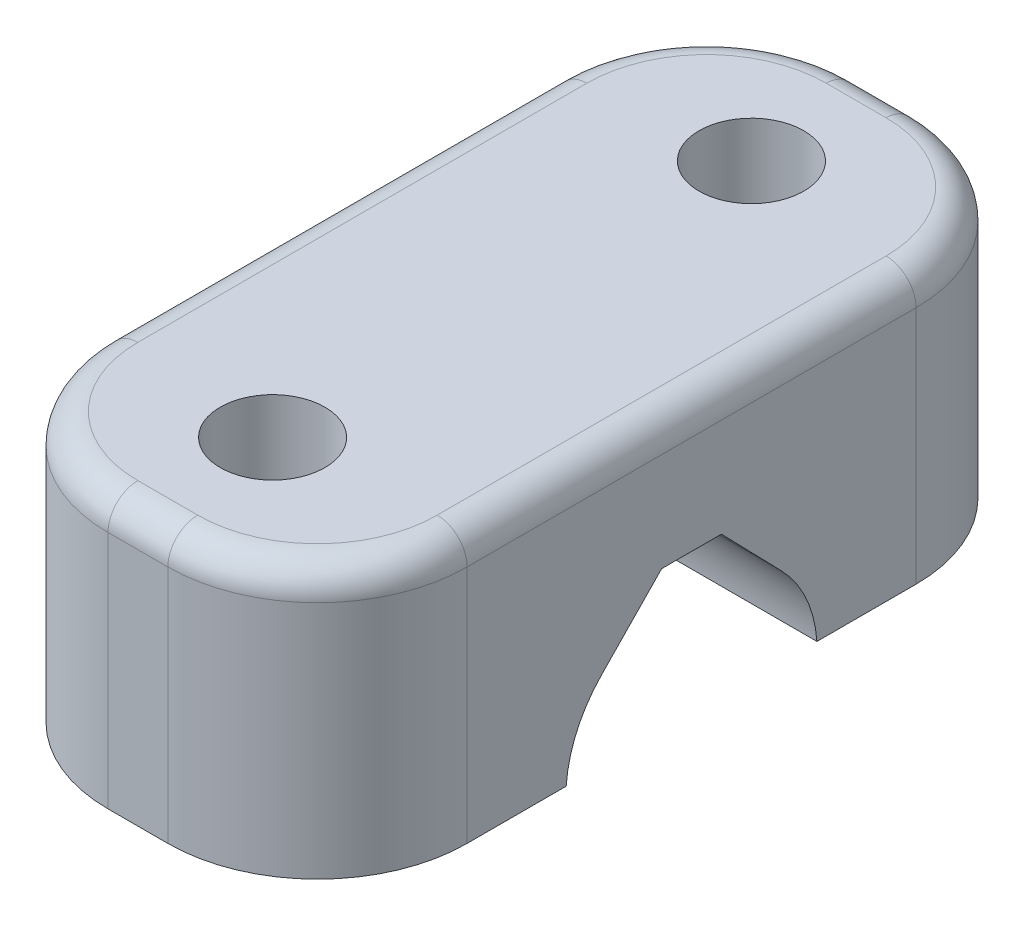
from build123d import *

# Parameters (mm, degrees)
CROQUIS1_W              = 12
CROQUIS1_H              = 25
SALIENTE_EXTRUIR1_DEPTH = 9
CORTAR_EXTRUIR1_DEPTH   = 20.52562419
CROQUIS4_R              = 1.75
CORTAR_EXTRUIR2_DEPTH   = 20.52562419
REDONDEO1_R             = 5
REDONDEO2_R             = 1


with BuildPart() as part:
    # Croquis1 → Saliente-Extruir1 (new body)
    with BuildSketch(Plane(origin=(0, 0, 0), x_dir=(1, 0, 0), z_dir=(0, 1, 0))):
        with Locations((6, 0)):
            Rectangle(CROQUIS1_W, CROQUIS1_H)
    extrude(amount=SALIENTE_EXTRUIR1_DEPTH)

    # Croquis3 → Cortar-Extruir1 (cut, through all)
    with BuildSketch(Plane(origin=(0, 0, 0), x_dir=(0, 0, -1), z_dir=(1, 0, 0))):
        with BuildLine():
            Line((-3.013795986, 2.625240803), (-1, 4.7))
            Line((-1, 4.7), (1, 4.7))
            Line((1, 4.7), (3.013795986, 2.625240803))
            ThreePointArc((3.013795986, 2.625240803), (0, -4.5), (-3.013795986, 2.625240803))
        make_face()
    extrude(amount=CORTAR_EXTRUIR1_DEPTH, mode=Mode.SUBTRACT)

    # Croquis4 → Cortar-Extruir2 (cut, through all)
    with BuildSketch(Plane.XZ):
        with Locations((6, 8)):
            Circle(CROQUIS4_R)
        with Locations((6, -8)):
            Circle(CROQUIS4_R)
    extrude(amount=-CORTAR_EXTRUIR2_DEPTH, mode=Mode.SUBTRACT)

    # Redondeo1
    redondeo1_edges = [part.edges().sort_by_distance(p)[0] for p in [
        (0, 4.5, -12.5),
        (12, 4.5, -12.5),
        (12, 4.5, 12.5),
        (0, 4.5, 12.5),
    ]]
    fillet(redondeo1_edges, radius=REDONDEO1_R)

    # Redondeo2
    redondeo2_edges = [part.edges().sort_by_distance(p)[0] for p in [
        (10.535533906, 9, -11.035533906),
        (12, 9, 0),
        (10.535533906, 9, 11.035533906),
        (6, 9, 12.5),
        (1.464466094, 9, 11.035533906),
        (0, 9, 0),
        (1.464466094, 9, -11.035533906),
        (6, 9, -12.5),
    ]]
    fillet(redondeo2_edges, radius=REDONDEO2_R)


solid = part.part
